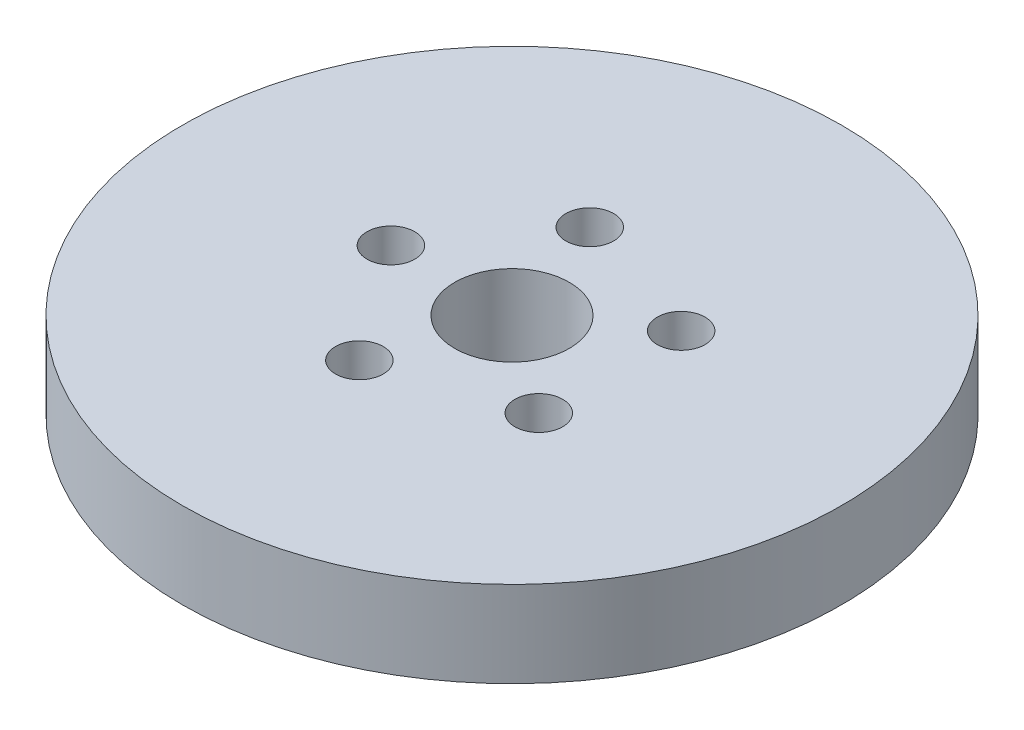
from build123d import *

# Parameters (mm, degrees)
SKETCH1_R           = 57.5
BOSS_EXTRUDE1_DEPTH = 15
SKETCH2_R           = 10
CUT_EXTRUDE1_DEPTH  = 83.689177043
SKETCH3_R           = 4.164692339
CUT_EXTRUDE2_DEPTH  = 9.502152281
CIRPATTERN1_COUNT   = 5


with BuildPart() as part:
    # Sketch1 → Boss-Extrude1 (new body)
    with BuildSketch(Plane(origin=(0, 0, 0), x_dir=(1, 0, 0), z_dir=(0, 1, 0))):
        Circle(SKETCH1_R)
    extrude(amount=BOSS_EXTRUDE1_DEPTH)

    # Sketch2 → Cut-Extrude1 (cut, through all)
    with BuildSketch(Plane(origin=(0, 0, 0), x_dir=(1, 0, 0), z_dir=(0, 1, 0))):
        Circle(SKETCH2_R)
    extrude(amount=CUT_EXTRUDE1_DEPTH, mode=Mode.SUBTRACT)

    # Sketch3 → Cut-Extrude2 (cut)
    with BuildSketch(Plane(origin=(0, 15, 0), x_dir=(1, 0, 0), z_dir=(0, 1, 0))):
        with Locations((-21.130985513, 0)):
            Circle(SKETCH3_R)
    cut_extrude2 = extrude(amount=-CUT_EXTRUDE2_DEPTH, mode=Mode.SUBTRACT)

    # CirPattern1: Cut-Extrude2 ×5 about axis
    cirpattern1_axis = Axis((0, 0, 0), (0, 1, 0))
    for i in range(1, CIRPATTERN1_COUNT):
        add(cut_extrude2.rotate(cirpattern1_axis, i * 360 / CIRPATTERN1_COUNT), mode=Mode.SUBTRACT)


solid = part.part
